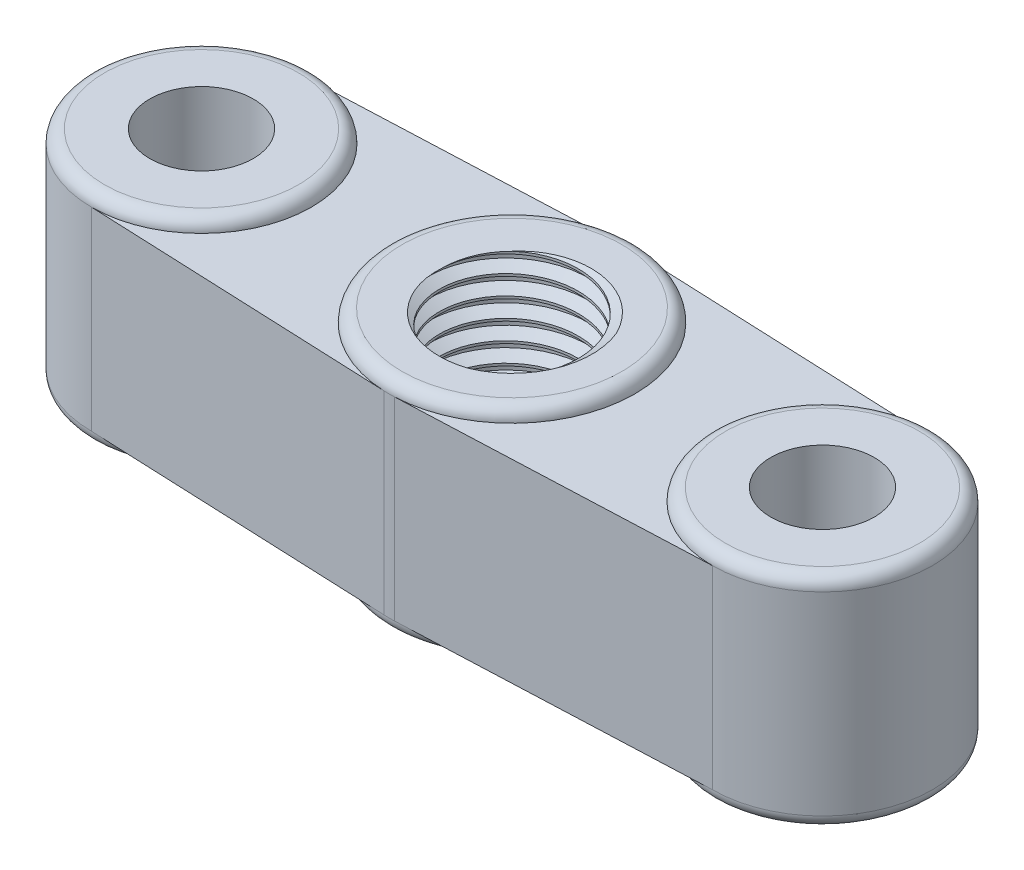
from build123d import *

# Parameters (mm, degrees)
SKETCH1_R           = 17
SKETCH1_R_2         = 11
SKETCH1_R_3         = 19
SKETCH1_R_4         = 10.75
BOSS_EXTRUDE1_DEPTH = 15
SKETCH1_5_R         = 17
SKETCH1_5_R_2       = 11
SKETCH1_5_R_3       = 19
SKETCH1_5_R_4       = 10.75
BOSS_EXTRUDE2_DEPTH = 17
SKETCH1_6_R         = 11
SKETCH1_6_R_2       = 8
BOSS_EXTRUDE3_DEPTH = 17
THREAD1_PITCH       = 3
FILLET1_R           = 2
FILLET2_R           = 2


with BuildPart() as part:
    # Sketch1 → Boss-Extrude1 (new, symmetric)
    # profile 1 of 5: a face of its own
    with BuildSketch(Plane(origin=(0, 0, 0), x_dir=(1, 0, 0), z_dir=(0, 1, 0))):
        with Locations((-48, 0)):
            Circle(SKETCH1_R)
        with Locations(Location((-48, 0, 0), (0, 0, 270))):
            Circle(SKETCH1_R_2, mode=Mode.SUBTRACT)
    # profile 2 of 5: a face of its own
    with BuildSketch(Plane(origin=(0, 0, 0), x_dir=(1, 0, 0), z_dir=(0, 1, 0))):
        with BuildLine():
            Line((-0.797598434, 18.98325148), (-48, 17))
            ThreePointArc((-48, 17), (-35.97918472, 12.02081528), (-31, 0))
            ThreePointArc((-31, 0), (-35.97918472, -12.02081528), (-48, -17))
            Line((-48, -17), (-0.797598434, -18.98325148))
            ThreePointArc((-0.797598434, -18.98325148), (-19, 0), (-0.797598434, 18.98325148))
        make_face()
    # profile 3 of 5: a face of its own
    with BuildSketch(Plane(origin=(0, 0, 0), x_dir=(1, 0, 0), z_dir=(0, 1, 0))):
        Circle(SKETCH1_R_3)
        with Locations(Location((0, 0, 0), (0, 0, 270))):
            Circle(SKETCH1_R_4, mode=Mode.SUBTRACT)
    # profile 4 of 5: a face of its own
    with BuildSketch(Plane(origin=(0, 0, 0), x_dir=(1, 0, 0), z_dir=(0, 1, 0))):
        with BuildLine():
            Line((48, 17), (0.797598434, 18.98325148))
            ThreePointArc((0.797598434, 18.98325148), (13.714123564, 13.150011972), (19, 0))
            ThreePointArc((19, 0), (13.714123564, -13.150011972), (0.797598434, -18.98325148))
            Line((0.797598434, -18.98325148), (48, -17))
            ThreePointArc((48, -17), (31, 0), (48, 17))
        make_face()
    # profile 5 of 5: a face of its own
    with BuildSketch(Plane(origin=(0, 0, 0), x_dir=(1, 0, 0), z_dir=(0, 1, 0))):
        with Locations((48, 0)):
            Circle(SKETCH1_R)
        with Locations(Location((48, 0, 0), (0, 0, 270))):
            Circle(SKETCH1_R_2, mode=Mode.SUBTRACT)
    extrude(amount=BOSS_EXTRUDE1_DEPTH, both=True)

    # Sketch1<5> → Boss-Extrude2 (add, symmetric)
    # profile 1 of 3: a face of its own
    with BuildSketch(Plane(origin=(0, 0, 0), x_dir=(1, 0, 0), z_dir=(0, 1, 0))):
        with Locations(Location((48, 0, 0), (0, 0, 270))):
            Circle(SKETCH1_5_R)
        with Locations(Location((48, 0, 0), (0, 0, 270))):
            Circle(SKETCH1_5_R_2, mode=Mode.SUBTRACT)
    # profile 2 of 3: a face of its own
    with BuildSketch(Plane(origin=(0, 0, 0), x_dir=(1, 0, 0), z_dir=(0, 1, 0))):
        with Locations(Location((0, 0, 0), (0, 0, 270))):
            Circle(SKETCH1_5_R_3)
        with Locations(Location((0, 0, 0), (0, 0, 270))):
            Circle(SKETCH1_5_R_4, mode=Mode.SUBTRACT)
    # profile 3 of 3: a face of its own
    with BuildSketch(Plane(origin=(0, 0, 0), x_dir=(1, 0, 0), z_dir=(0, 1, 0))):
        with Locations(Location((-48, 0, 0), (0, 0, 270))):
            Circle(SKETCH1_5_R)
        with Locations(Location((-48, 0, 0), (0, 0, 270))):
            Circle(SKETCH1_5_R_2, mode=Mode.SUBTRACT)
    extrude(amount=BOSS_EXTRUDE2_DEPTH, both=True)

    # Sketch1<6> → Boss-Extrude3 (add)
    # profile 1 of 2: a face of its own
    with BuildSketch(Plane(origin=(0, 0, 0), x_dir=(1, 0, 0), z_dir=(0, 1, 0))):
        with Locations(Location((-48, 0, 0), (0, 0, 270))):
            Circle(SKETCH1_6_R)
        with Locations(Location((-48, 0, 0), (0, 0, 270))):
            Circle(SKETCH1_6_R_2, mode=Mode.SUBTRACT)
    # profile 2 of 2: a face of its own
    with BuildSketch(Plane(origin=(0, 0, 0), x_dir=(1, 0, 0), z_dir=(0, 1, 0))):
        with Locations(Location((48, 0, 0), (0, 0, 270))):
            Circle(SKETCH1_6_R)
        with Locations(Location((48, 0, 0), (0, 0, 270))):
            Circle(SKETCH1_6_R_2, mode=Mode.SUBTRACT)
    extrude(amount=BOSS_EXTRUDE3_DEPTH)

    # Thread1: the profile of Thread Profile1 profile screwed along a right-hand helix of 12.333333 turns, 10 arcs to a turn; built about Z, then put on its axis
    thread1_z = Axis((0, 0, 0), (0, 0, 1))
    thread1_corners = [(10.7497, 0, -0.000173205), (10.7497, 0, 2.625173197), (12.373797625, 0, 1.687499996), (12.373797625, 0, 0.937499996)]
    with BuildLine(mode=Mode.PRIVATE) as thread1_profile:
        Line(thread1_corners[0], thread1_corners[1])
        Line(thread1_corners[1], thread1_corners[2])
        Line(thread1_corners[2], thread1_corners[3])
        Line(thread1_corners[3], thread1_corners[0])
    thread1_cap = Face(thread1_profile.wire())
    thread1_turn_angles = [0, 18, 36, 54, 72, 90, 108, 126, 144, 162, 180, 198, 216, 234, 252, 270, 288, 306, 324, 342, 360]
    thread1_turn_weights = [1, 0.9510565162951535, 1, 0.9510565162951535, 1, 0.9510565162951535, 1, 0.9510565162951535, 1, 0.9510565162951535, 1, 0.9510565162951535, 1, 0.9510565162951535, 1, 0.9510565162951535, 1, 0.9510565162951535, 1, 0.9510565162951535, 1]
    thread1_turn_rails = [Edge.make_bspline([Vector(p[0], p[1], 0).rotate(thread1_z, thread1_turn_angles[k]) / thread1_turn_weights[k] + Vector(0, 0, p[2] + THREAD1_PITCH * thread1_turn_angles[k] / 360) for k in range(21)], [0, 0, 0, 1, 1, 2, 2, 3, 3, 4, 4, 5, 5, 6, 6, 7, 7, 8, 8, 9, 9, 10, 10, 10], 2, thread1_turn_weights) for p in thread1_corners]
    thread1_turn_sides = [Face.make_surface_from_curves(thread1_turn_rails[p[0]], thread1_turn_rails[p[1]]) for p in [(0, 1), (1, 2), (2, 3), (3, 0)]]
    thread1_last_angles = [4320, 4338, 4356, 4374, 4392, 4410, 4428, 4434, 4440]
    thread1_last_weights = [1, 0.9510565162951535, 1, 0.9510565162951535, 1, 0.9510565162951535, 1, 0.9945218953682742, 1]
    thread1_last_rails = [Edge.make_bspline([Vector(p[0], p[1], 0).rotate(thread1_z, thread1_last_angles[k]) / thread1_last_weights[k] + Vector(0, 0, p[2] + THREAD1_PITCH * thread1_last_angles[k] / 360) for k in range(9)], [0, 0, 0, 1, 1, 2, 2, 3, 3, 4, 4, 4], 2, thread1_last_weights) for p in thread1_corners]
    thread1_last_sides = [Face.make_surface_from_curves(thread1_last_rails[p[0]], thread1_last_rails[p[1]]) for p in [(0, 1), (1, 2), (2, 3), (3, 0)]]
    thread1 = Plane(origin=(0, 20, 0), x_dir=(-1, 0, 0), z_dir=(0, -1, 0)) * Solid(Shell([*[p.moved(Location((0, 0, THREAD1_PITCH * i))) for i in range(12) for p in thread1_turn_sides], *thread1_last_sides, thread1_cap, thread1_cap.rotate(thread1_z, 4440).moved(Location((0, 0, THREAD1_PITCH * 4440 / 360)))]))
    add(thread1, mode=Mode.SUBTRACT)

    # Fillet1
    fillet1_edges = [part.edges().sort_by_distance(p)[0] for p in [
        (48, 17, -17),
        (0, 17, -19),
        (-48, 17, -17),
    ]]
    fillet(fillet1_edges, radius=FILLET1_R - 0.0001)  # a hair under: the kernel refuses the full size

    # Fillet2
    fillet2_edges = [part.edges().sort_by_distance(p)[0] for p in [
        (48, -17, -17),
        (0, -17, -19),
        (-48, -17, -17),
    ]]
    fillet(fillet2_edges, radius=FILLET2_R - 0.0001)  # a hair under: the kernel refuses the full size


solid = part.part
